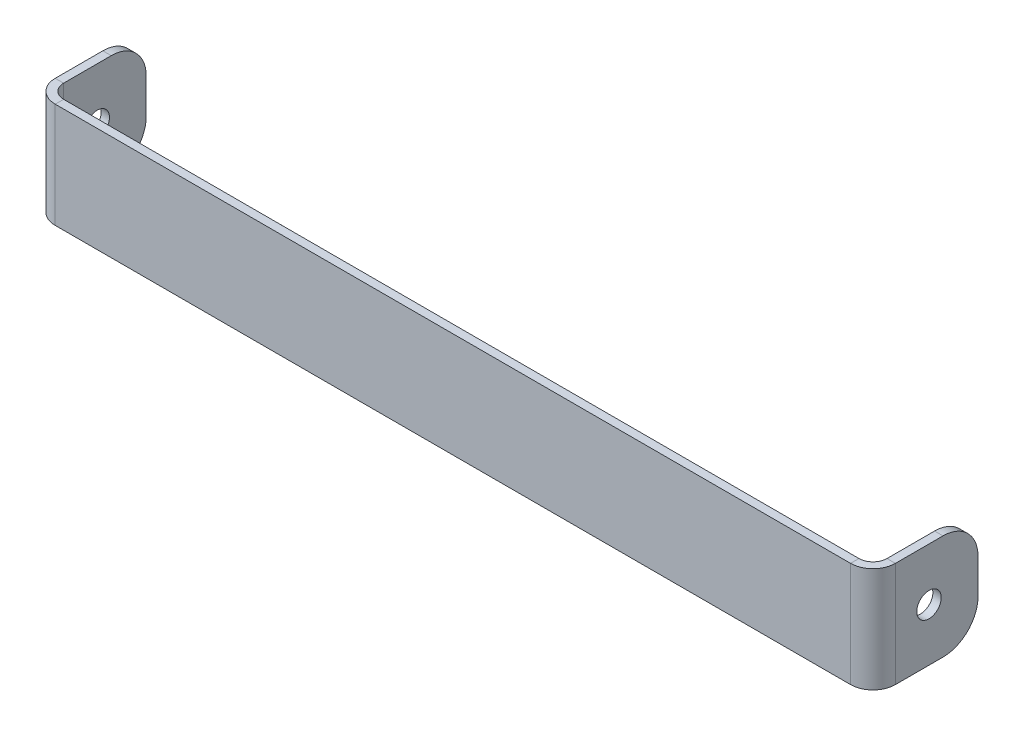
from build123d import *

# Parameters (mm, degrees)
ESBO_O1_W                        = 120
ESBO_O1_H                        = 15
FLANGE_BASE1_DEPTH               = 1.2
ARESTA_FLANGE1_STRIP_W           = 8.8
ARESTA_FLANGE1_STRIP_H           = 1.2
ARESTA_FLANGE1_STRIP_CUT_DEPTH   = 15
ARESTA_FLANGE1_STRIP_2_W         = 8.8
ARESTA_FLANGE1_STRIP_2_H         = 1.2
ARESTA_FLANGE1_STRIP_CUT_2_DEPTH = 15
ARESTA_FLANGE1_DEPTH             = 15
ARESTA_FLANGE1_BEND_DEPTH        = 15
QUEBRA_CANTO1_DEPTH              = 120
FURO_DE_DI_METRO_3_5_3_5_1_D     = 3.5
FURO_DE_DI_METRO_3_5_3_5_1_DEPTH = 1.2
FURO_DE_DI_METRO_3_5_3_5_2_D     = 3.5


# Read off the part's stored shape, not the designer's step: Quebra-Canto1
# Sheet-metal steps are written as plain solids
with BuildPart() as part:
    # Esboço1 → Flange-base1 (new body)
    with BuildSketch(Plane.XY):
        with Locations((60, 7.5)):
            Rectangle(ESBO_O1_W, ESBO_O1_H)
    extrude(amount=-FLANGE_BASE1_DEPTH)

    # Aresta-Flange1 strip (across the edge) → Aresta-Flange1 strip cut (cut)
    with BuildSketch(Plane(origin=(120, 15, -1.2), x_dir=(-1, 0, 0), z_dir=(0, -1, 0))):
        with Locations((-1.2, -0.6)):
            Rectangle(ARESTA_FLANGE1_STRIP_W, ARESTA_FLANGE1_STRIP_H)
    extrude(amount=ARESTA_FLANGE1_STRIP_CUT_DEPTH, mode=Mode.SUBTRACT)

    # Aresta-Flange1 strip 2 (across the edge) → Aresta-Flange1 strip cut 2 (cut)
    with BuildSketch(Plane(origin=(0, 0, -1.2), x_dir=(1, 0, 0), z_dir=(0, 1, 0))):
        with Locations((-1.2, -0.6)):
            Rectangle(ARESTA_FLANGE1_STRIP_2_W, ARESTA_FLANGE1_STRIP_2_H)
    extrude(amount=ARESTA_FLANGE1_STRIP_CUT_2_DEPTH, mode=Mode.SUBTRACT)

    # Aresta-Flange1 section (across the edge) → Aresta-Flange1 (add)
    with BuildSketch(Plane(origin=(120, 15, -1.2), x_dir=(-1, 0, 0), z_dir=(0, -1, 0))):
        with BuildLine():
            Line((0, 2), (0, 13.8))
            Line((0, 13.8), (1.2, 13.8))
            Line((1.2, 13.8), (1.2, 2))
            ThreePointArc((1.2, 2), (1.785786438, 0.585786438), (3.2, 0))
            Line((3.2, 0), (3.2, -1.2))
            ThreePointArc((3.2, -1.2), (0.9372583, -0.2627417), (0, 2))
        make_face()
    extrude(amount=ARESTA_FLANGE1_DEPTH)

    # Aresta-Flange1 section 2 (across the edge) → Aresta-Flange1 bend (add)
    with BuildSketch(Plane(origin=(0, 0, -1.2), x_dir=(1, 0, 0), z_dir=(0, 1, 0))):
        with BuildLine():
            Line((0, 2), (0, 13.8))
            Line((0, 13.8), (1.2, 13.8))
            Line((1.2, 13.8), (1.2, 2))
            ThreePointArc((1.2, 2), (1.785786438, 0.585786438), (3.2, 0))
            Line((3.2, 0), (3.2, -1.2))
            ThreePointArc((3.2, -1.2), (0.9372583, -0.2627417), (0, 2))
        make_face()
    extrude(amount=ARESTA_FLANGE1_BEND_DEPTH)

    # Quebra-Canto1 outline → Quebra-Canto1 (cut)
    with BuildSketch(Plane.YZ):
        with BuildLine():
            Line((15, -15), (15, -10))
            ThreePointArc((15, -10), (13.535533906, -13.535533906), (10, -15))
            Line((10, -15), (15, -15))
        make_face()
        with BuildLine():
            Line((0, -15), (5, -15))
            ThreePointArc((5, -15), (1.464466094, -13.535533906), (0, -10))
            Line((0, -10), (0, -15))
        make_face()
    extrude(amount=QUEBRA_CANTO1_DEPTH, mode=Mode.SUBTRACT)

    # Furo de diâmetro Ø3.5 (3.5)1
    with Locations(Plane(origin=(120, 0, 0), x_dir=(0, 0, -1), z_dir=(1, 0, 0))):
        with Locations((8, 7.5)):
            Hole(FURO_DE_DI_METRO_3_5_3_5_1_D / 2, depth=FURO_DE_DI_METRO_3_5_3_5_1_DEPTH)

    # Furo de diâmetro Ø3.5 (3.5)2 (through all)
    with Locations(Plane.ZY):
        with Locations((-8, 7.5)):
            Hole(FURO_DE_DI_METRO_3_5_3_5_2_D / 2)


solid = part.part
